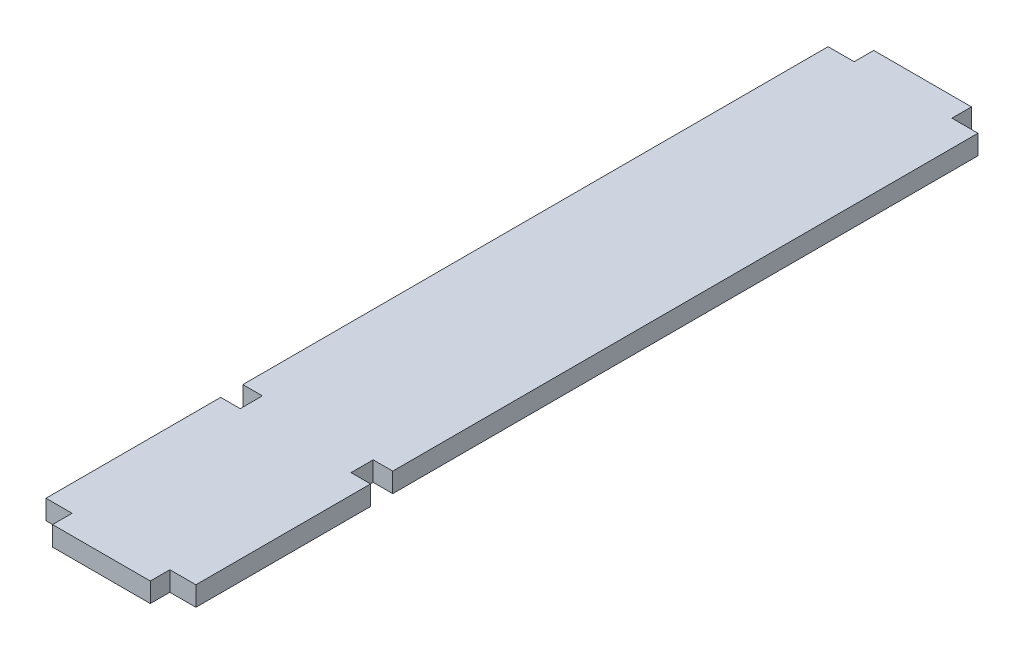
from build123d import *

# Parameters (mm, degrees)
BOSS_EXTRUDE1_DEPTH = 1.5


with BuildPart() as part:
    # Sketch1 → Boss-Extrude1 (new body)
    with BuildSketch(Plane(origin=(0, 0, 0), x_dir=(1, 0, 0), z_dir=(0, 1, 0))):
        Polygon((3.75, 30), (5.75, 30), (5.75, -14.9), (4.25, -14.9), (4.25, -16.6), (5.75, -16.6), (5.75, -30), (3.75, -30), (3.75, -31.5), (-3.75, -31.5), (-3.75, -30), (-5.75, -30), (-5.75, -16.6), (-4.25, -16.6), (-4.25, -14.9), (-5.75, -14.9), (-5.75, 30), (-3.75, 30), (-3.75, 31.5), (3.75, 31.5), align=None)
    extrude(amount=BOSS_EXTRUDE1_DEPTH)


solid = part.part
